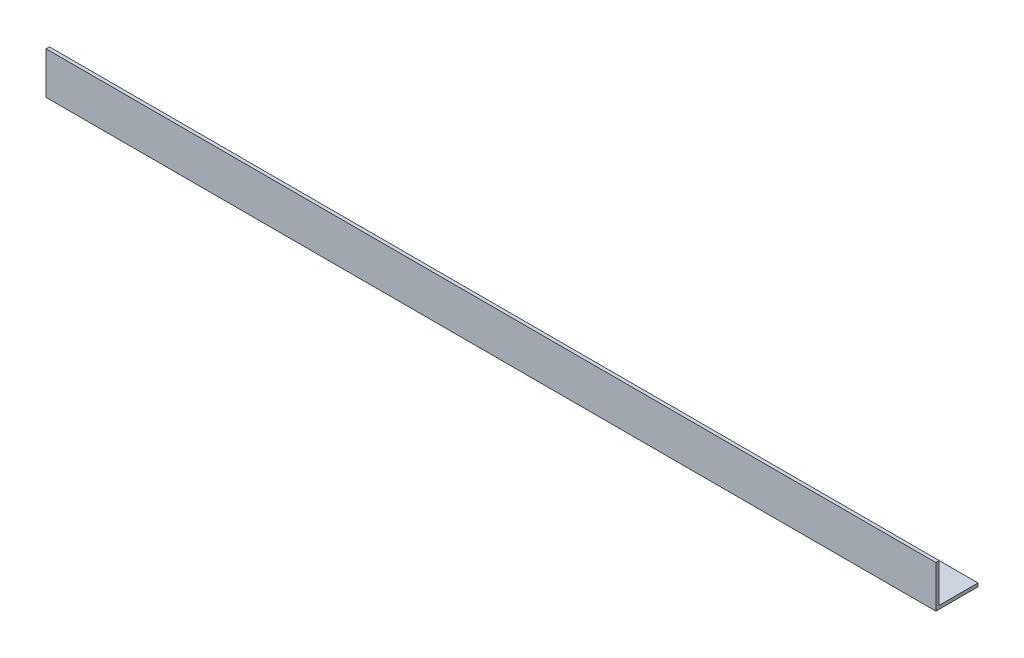
from build123d import *

# Parameters (mm, degrees)
EXTRUDE_1_DEPTH = 528


with BuildPart() as part:
    # Эскиз1 → Вытянуть-Тонкостенный1 (new body)
    with BuildSketch(Plane(origin=(0, 0, 0), x_dir=(0, 0, -1), z_dir=(1, 0, 0))):
        Polygon((0, 25), (0, 0), (25, 0), (25, 2), (2, 2), (2, 25), align=None)
    extrude(amount=EXTRUDE_1_DEPTH)


solid = part.part
